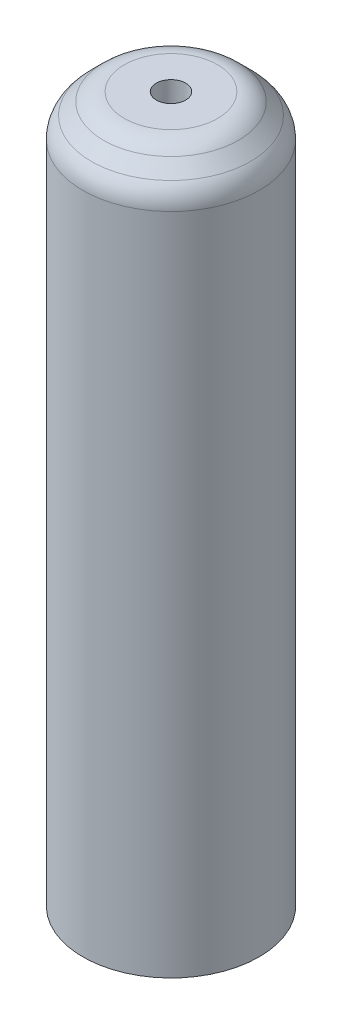
from build123d import *

# Parameters (mm, degrees)
CHAMFER1_SIZE = 1
FILLET1_R     = 1


with BuildPart() as part:
    # Sketch1 → Revolve1 (revolve)
    with BuildSketch(Plane.XY):
        Polygon((3, 0), (3, 24), (0.5, 24), (0.5, 22), (1, 21.5), (1, 0), align=None)
    revolve(axis=Axis((0, -1000, 0), (0, 1, 0)))

    # Chamfer1
    chamfer1_edges = [part.edges().sort_by_distance(p)[0] for p in [
        (-3, 24, 0),
    ]]
    chamfer(chamfer1_edges, length=CHAMFER1_SIZE)

    # Fillet1
    fillet1_edges = [part.edges().sort_by_distance(p)[0] for p in [
        (-2, 24, 0),
        (-3, 23, 0),
    ]]
    fillet(fillet1_edges, radius=FILLET1_R)


solid = part.part
